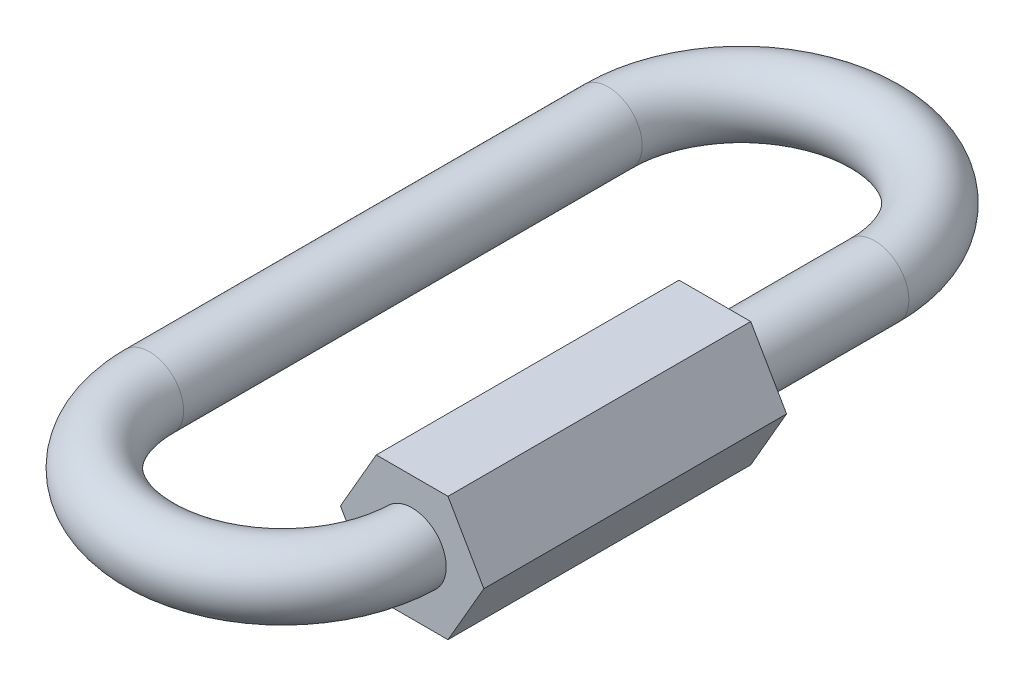
from build123d import *

# Parameters (mm, degrees)
SWEEP1_START             = -29.3624001
SWEEP1_OUTLINE_R         = 2.1844
SWEEP1_DEPTH             = 29.3624001
SWEEP1_2_OUTLINE_R       = 2.1844
SWEEP1_2_ANGLE           = 180
SWEEP1_3_OUTLINE_R       = 2.1844
SWEEP1_3_ANGLE           = 180
BOSS_EXTRUDE1_DEPTH      = 0.254
BOSS_EXTRUDE1_DEPTH_BACK = 19.1262


with BuildPart() as part:
    # Sweep1: read off the stored shape, not the designer's step
    # Sweep1 outline → Sweep1 (new body)
    with BuildSketch(Plane.XY.offset(SWEEP1_START)):
        with Locations((8.5344, 0)):
            Circle(SWEEP1_OUTLINE_R)
        with Locations((-8.5344, 0)):
            Circle(SWEEP1_OUTLINE_R)
    extrude(amount=SWEEP1_DEPTH)

    # Sweep1 2 outline → Sweep1 2 (revolve)
    with BuildSketch(Plane.XY.offset(-29.3624)):
        with Locations((8.5344, 0)):
            Circle(SWEEP1_2_OUTLINE_R)
    revolve(axis=Axis((0, 0, -29.3624), (0, 1, 0)), revolution_arc=SWEEP1_2_ANGLE)

    # Sweep1 3 outline → Sweep1 3 (revolve)
    with BuildSketch(Plane(origin=(0, 0, 0), x_dir=(-1, 0, 0), z_dir=(0, 0, -1))):
        with Locations((8.5344, 0)):
            Circle(SWEEP1_3_OUTLINE_R)
    revolve(axis=Axis((0, 0, 0), (0, 1, 0)), revolution_arc=SWEEP1_3_ANGLE)

    # Sketch2 → Boss-Extrude1 (add, two sides: drawn at the far end of the back side and taken through both)
    with BuildSketch(Plane.XY.offset(-BOSS_EXTRUDE1_DEPTH_BACK)):
        Polygon((13.12445011, 0), (10.829425055, 3.9751), (6.239374945, 3.9751), (3.94434989, 0), (6.239374945, -3.9751), (10.829425055, -3.9751), align=None)
    extrude(amount=BOSS_EXTRUDE1_DEPTH + BOSS_EXTRUDE1_DEPTH_BACK)


solid = part.part
